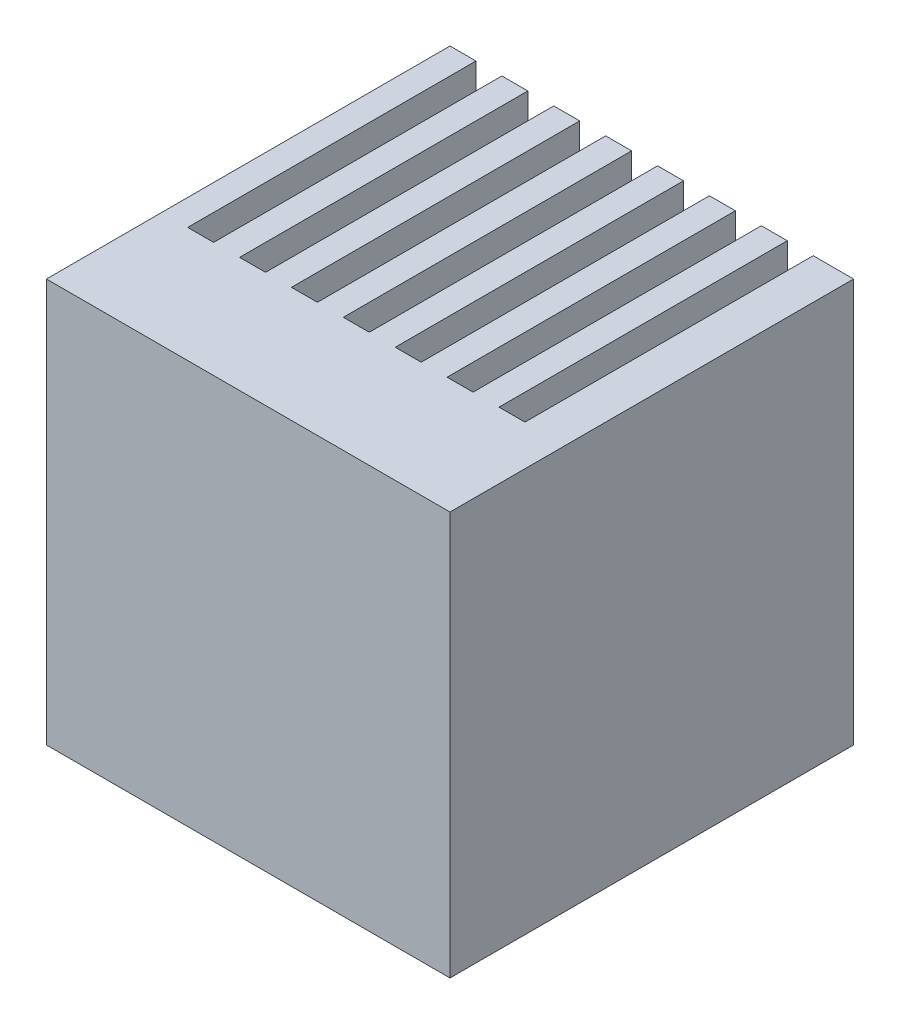
from build123d import *

# Parameters (mm, degrees)
SKETCH_2_W             = 28
SKETCH_2_H             = 28
EXTRUDE_1_DEPTH        = 28
SKETCH_3_W             = 1.8
SKETCH_3_H             = 20
CUT_EXTRUDE_1_DEPTH    = 49.497422612
PATTERN_LINEAR_6_COUNT = 7
PATTERN_LINEAR_6_PITCH = 3.6


with BuildPart() as part:
    # 草图2 → 凸台-拉伸1 (new body)
    with BuildSketch(Plane(origin=(0, 0, 0), x_dir=(1, 0, 0), z_dir=(0, 1, 0))):
        with Locations((14, -14)):
            Rectangle(SKETCH_2_W, SKETCH_2_H)
    extrude(amount=EXTRUDE_1_DEPTH)

    # 草图3 → 切除-拉伸1 (cut, through all)
    with BuildSketch(Plane(origin=(0, 28, 0), x_dir=(1, 0, 0), z_dir=(0, 1, 0))):
        with Locations((2.7, -10)):
            Rectangle(SKETCH_3_W, SKETCH_3_H)
    cut_extrude_1 = extrude(amount=-CUT_EXTRUDE_1_DEPTH, mode=Mode.SUBTRACT)

    # 阵列(线性)6: 切除-拉伸1 ×7
    with Locations(*[(i * PATTERN_LINEAR_6_PITCH, 0, 0) for i in range(1, PATTERN_LINEAR_6_COUNT)]):
        add(cut_extrude_1, mode=Mode.SUBTRACT)


solid = part.part
